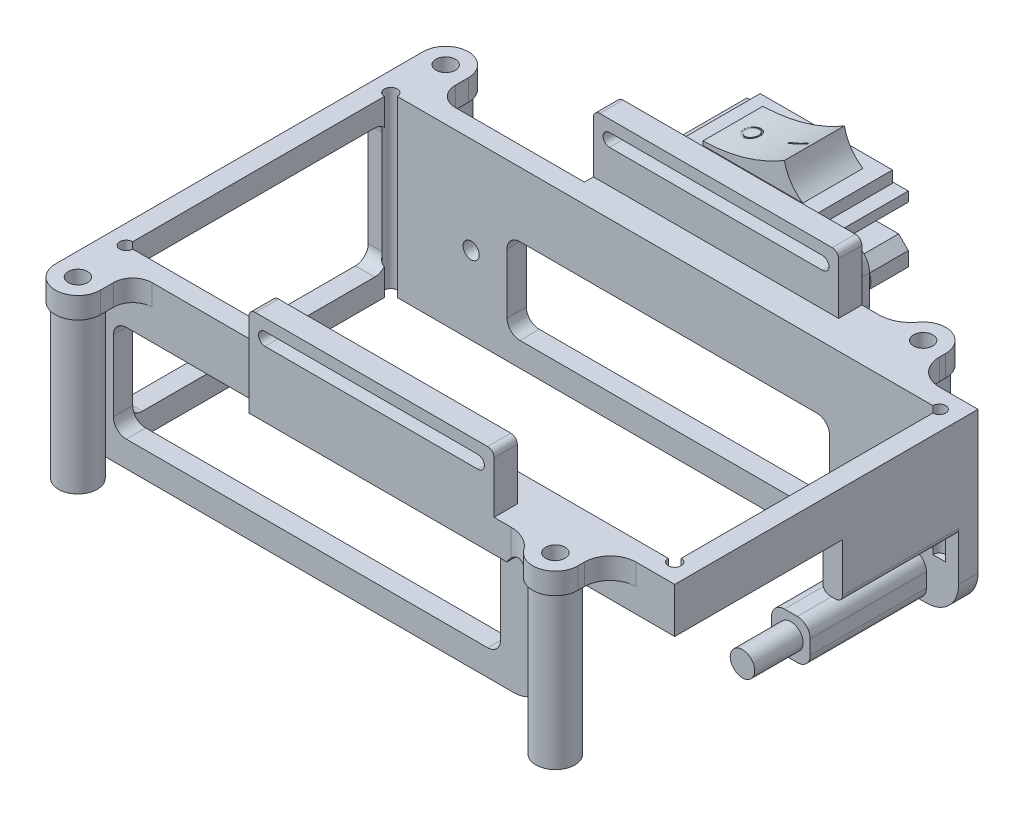
from build123d import *

# Parameters (mm, degrees)
SKETCH_1_W          = 91
SKETCH_1_H          = 47
EXTRUDE_1_DEPTH     = 27
SKETCH_2_R          = 1.5
EXTRUDE_2_DEPTH     = 3.3
SKETCH_3_W          = 38
SKETCH_3_H          = 5
SKETCH_3_W_2        = 4
SKETCH_3_H_2        = 3.3
EXTRUDE_3_DEPTH     = 5
CUT_EXTRUDE_1_DEPTH = 1.4
FILLET_1_R          = 3
FILLET_2_R          = 5
FILLET_3_R          = 4
FILLET_4_R          = 5
FILLET_5_R          = 4
FILLET_START        = -28.952063768
FILLET_6_DEPTH      = 5.952063768
FILLET_START_2      = 21
FILLET_6_2_DEPTH    = 2.7
CUT_EXTRUDE_2_DEPTH = 18.4
SKETCH_6_R          = 1.25
CUT_EXTRUDE_3_DEPTH = 18.4
CUT_EXTRUDE_4_DEPTH = 18.4
CUT_EXTRUDE_5_DEPTH = 26
FILLET_7_R          = 5
SKETCH_9_W          = 3
SKETCH_9_H          = 11.5
CUT_EXTRUDE_6_DEPTH = 18
FILLET_8_R          = 1
SKETCH_10_W         = 10
SKETCH_10_H         = 3
EXTRUDE_4_DEPTH     = 7
FILLET_9_R          = 5
EXTRUDE_5_DEPTH     = 18
SKETCH_12_R         = 1.9
EXTRUDE_6_DEPTH     = 7.5
SKETCH_13_R         = 3
SKETCH_13_R_2       = 1.5
EXTRUDE_7_DEPTH     = 23.7
EXTRUDE_8_DEPTH     = 2.7
SKETCH_15_R         = 2.5
EXTRUDE_9_DEPTH     = 1
SKETCH_17_R         = 1.25
EXTRUDE_10_DEPTH    = 11
SKETCH_18_W         = 20.5
SKETCH_18_H         = 13.5
EXTRUDE_12_DEPTH    = 1.8
EXTRUDE_13_DEPTH    = 4.65
SKETCH_20_R         = 1.25
SKETCH_20_R_2       = 1
SKETCH_20_W         = 3
SKETCH_20_H         = 0.25
CUT_EXTRUDE_7_DEPTH = 9.3


with BuildPart() as part:
    # 草图1 → 凸台-拉伸1 (new body)
    with BuildSketch(Plane(origin=(0, 0, 0), x_dir=(1, 0, 0), z_dir=(0, 1, 0))):
        Rectangle(SKETCH_1_W, SKETCH_1_H)
        with BuildLine():
            Line((-41.5, 20.5), (41.5, 20.5))
            ThreePointArc((41.5, 20.5), (43.207106781, 21.207106781), (42.5, 19.5))
            Line((42.5, 19.5), (42.5, -19.5))
            ThreePointArc((42.5, -19.5), (43.207106781, -21.207106781), (41.5, -20.5))
            Line((41.5, -20.5), (-41.5, -20.5))
            ThreePointArc((-41.5, -20.5), (-43.207106781, -21.207106781), (-42.5, -19.5))
            Line((-42.5, -19.5), (-42.5, 19.5))
            ThreePointArc((-42.5, 19.5), (-43.207106781, 21.207106781), (-41.5, 20.5))
        make_face(mode=Mode.SUBTRACT)
    extrude(amount=EXTRUDE_1_DEPTH)

    # 草图2 → 凸台-拉伸2 (add)
    # profile 1 of 4: a face of its own
    with BuildSketch(Plane(origin=(0, 27, 0), x_dir=(1, 0, 0), z_dir=(0, 1, 0))):
        with BuildLine():
            Line((-45.5, -23.5), (-45.5, -28.5))
            ThreePointArc((-45.5, -28.5), (-42, -32), (-38.5, -28.5))
            Line((-38.5, -28.5), (-38.5, -26.5))
            ThreePointArc((-38.5, -26.5), (-37.621320344, -24.378679656), (-35.5, -23.5))
            Line((-35.5, -23.5), (-45.5, -23.5))
        make_face()
        with Locations(Location((-42, -28.5, 0), (0, 0, 270))):
            Circle(SKETCH_2_R, mode=Mode.SUBTRACT)
    # profile 2 of 4: a face of its own
    with BuildSketch(Plane(origin=(0, 27, 0), x_dir=(1, 0, 0), z_dir=(0, 1, 0))):
        with BuildLine():
            ThreePointArc((-38.5, 28.5), (-42, 32), (-45.5, 28.5))
            Line((-45.5, 28.5), (-45.5, 23.5))
            Line((-45.5, 23.5), (-35.5, 23.5))
            ThreePointArc((-35.5, 23.5), (-37.621320344, 24.378679656), (-38.5, 26.5))
            Line((-38.5, 26.5), (-38.5, 28.5))
        make_face()
        with Locations(Location((-42, 28.5, 0), (0, 0, 270))):
            Circle(SKETCH_2_R, mode=Mode.SUBTRACT)
    # profile 3 of 4: a face of its own
    with BuildSketch(Plane(origin=(0, 27, 0), x_dir=(1, 0, 0), z_dir=(0, 1, 0))):
        with BuildLine():
            Line((28.5, -23.5), (28.5, -28.5))
            ThreePointArc((28.5, -28.5), (32, -32), (35.5, -28.5))
            Line((35.5, -28.5), (35.5, -23.5))
            Line((35.5, -23.5), (28.5, -23.5))
        make_face()
        with Locations(Location((32, -28.5, 0), (0, 0, 270))):
            Circle(SKETCH_2_R, mode=Mode.SUBTRACT)
    # profile 4 of 4: a face of its own
    with BuildSketch(Plane(origin=(0, 27, 0), x_dir=(1, 0, 0), z_dir=(0, 1, 0))):
        with BuildLine():
            Line((28.5, 23.5), (35.5, 23.5))
            Line((35.5, 23.5), (35.5, 28.5))
            ThreePointArc((35.5, 28.5), (32, 32), (28.5, 28.5))
            Line((28.5, 28.5), (28.5, 23.5))
        make_face()
        with Locations(Location((32, 28.5, 0), (0, 0, 270))):
            Circle(SKETCH_2_R, mode=Mode.SUBTRACT)
    extrude(amount=-EXTRUDE_2_DEPTH)

    # 草图3 → 凸台-拉伸3 (add)
    # profile 1 of 4: a face of its own
    with BuildSketch(Plane.XY.offset(23.5)):
        with BuildLine():
            Line((21.5, 36), (-14.5, 36))
            ThreePointArc((-14.5, 36), (-15.207106781, 35.707106781), (-15.5, 35))
            Line((-15.5, 35), (-15.5, 27))
            Line((-15.5, 27), (22.5, 27))
            Line((22.5, 27), (22.5, 35))
            ThreePointArc((22.5, 35), (22.207106781, 35.707106781), (21.5, 36))
        make_face()
        with BuildLine():
            ThreePointArc((-13, 32.2), (-14, 33.2), (-13, 34.2))
            Line((-13, 34.2), (20, 34.2))
            ThreePointArc((20, 34.2), (21, 33.2), (20, 32.2))
            Line((20, 32.2), (-13, 32.2))
        make_face(mode=Mode.SUBTRACT)
    # profile 2 of 4: a face of its own
    with BuildSketch(Plane.XY.offset(23.5)):
        with Locations((3.5, 24.5)):
            Rectangle(SKETCH_3_W, SKETCH_3_H)
    # profile 3 of 4: a face of its own
    with BuildSketch(Plane.XY.offset(23.5)):
        Polygon((24.5, 27), (22.5, 27), (22.5, 22), (24.5, 22), (24.5, 23.7), align=None)
    # profile 4 of 4: a face of its own
    with BuildSketch(Plane.XY.offset(23.5)):
        with Locations((26.5, 25.35)):
            Rectangle(SKETCH_3_W_2, SKETCH_3_H_2)
    extrude_3 = extrude(amount=EXTRUDE_3_DEPTH)

    # 草图4 → 切除-拉伸1 (cut)
    with BuildSketch(Plane(origin=(0, 0, 23.5), x_dir=(-1, 0, 0), z_dir=(0, 0, -1))):
        with BuildLine():
            Line((-22.5, 27), (15.5, 27))
            Line((15.5, 27), (15.5, 35))
            ThreePointArc((15.5, 35), (15.207106781, 35.707106781), (14.5, 36))
            Line((14.5, 36), (-21.5, 36))
            ThreePointArc((-21.5, 36), (-22.207106781, 35.707106781), (-22.5, 35))
            Line((-22.5, 35), (-22.5, 27))
        make_face()
    cut_extrude_1 = extrude(amount=-CUT_EXTRUDE_1_DEPTH, mode=Mode.SUBTRACT)

    # 圆角1
    # the kernel refuses this fillet: 3 mm, written as the material it adds along each edge
    with BuildSketch(Plane(origin=(24.5, 23.7, 23.5), x_dir=(1, 0, 0), z_dir=(0, 0, 1))) as fillet_1_piece_1:
        with BuildLine():
            CenterArc((2.703701167, -3), FILLET_1_R, 90, 64.320711381)
            Line((0, -1.7), (-0.054074023, -1.674))
            ThreePointArc((-0.054074023, -1.674), (-0.06, -0.85), (-0.06, 0))
            Line((-0.06, 0), (0, 0.06))
            Line((0, 0.06), (2.703701167, 0.06))
            Line((2.703701167, 0.06), (2.703701167, 0))
        make_face()
    extrude(amount=5)

    # 圆角2
    fillet_2_edges = [part.edges().sort_by_distance(p)[0] for p in [
        (28.5, 25.35, 28.5),
    ]]
    fillet(fillet_2_edges, radius=FILLET_2_R)

    # 圆角3
    fillet_3_edges = [part.edges().sort_by_distance(p)[0] for p in [
        (35.5, 25.35, 23.5),
    ]]
    fillet(fillet_3_edges, radius=FILLET_3_R)

    # 镜向3: 凸台-拉伸3, 切除-拉伸1 across plane
    add(extrude_3.mirror(Plane.XY))
    add(cut_extrude_1.mirror(Plane.XY), mode=Mode.SUBTRACT)

    # 圆角4
    fillet_4_edges = [part.edges().sort_by_distance(p)[0] for p in [
        (28.5, 25.35, -28.5),
    ]]
    fillet(fillet_4_edges, radius=FILLET_4_R)

    # 圆角5
    fillet_5_edges = [part.edges().sort_by_distance(p)[0] for p in [
        (35.5, 25.35, -23.5),
    ]]
    fillet(fillet_5_edges, radius=FILLET_5_R)

    # 圆角6: read off the stored shape, not the designer's step
    # 圆角6 outline → 圆角6 (add)
    with BuildSketch(Plane.XY.offset(FILLET_START)):
        with BuildLine():
            Line((24.5, 23.7), (24.5, 22))
            ThreePointArc((24.5, 22), (25.606829225, 23.23968502), (27.203701167, 23.7))
            Line((27.203701167, 23.7), (24.5, 23.7))
        make_face()
    extrude(amount=FILLET_6_DEPTH)

    # Fillet 6 2 outline → Fillet 6 2 (cut)
    with BuildSketch(Plane(origin=(0, 0, 0), x_dir=(1, 0, 0), z_dir=(0, 1, 0)).offset(FILLET_START_2)):
        with BuildLine():
            Line((24.5, 28.5), (25.126136458, 28.5))
            ThreePointArc((25.126136458, 28.5), (26.189225924, 28.614322894), (27.203701205, 28.952063686))
            Line((27.203701205, 28.952063686), (24.5, 28.952063768))
            Line((24.5, 28.952063768), (24.5, 28.5))
        make_face()
    extrude(amount=FILLET_6_2_DEPTH, mode=Mode.SUBTRACT)

    # 草图5 → 切除-拉伸2 (cut)
    with BuildSketch(Plane.ZY.offset(45.5)):
        with BuildLine():
            Line((-18, 23.5), (18, 23.5))
            ThreePointArc((18, 23.5), (19.414213562, 22.914213562), (20, 21.5))
            Line((20, 21.5), (20, 5.5))
            ThreePointArc((20, 5.5), (19.414213562, 4.085786438), (18, 3.5))
            Line((18, 3.5), (-18, 3.5))
            ThreePointArc((-18, 3.5), (-19.414213562, 4.085786438), (-20, 5.5))
            Line((-20, 5.5), (-20, 21.5))
            ThreePointArc((-20, 21.5), (-19.414213562, 22.914213562), (-18, 23.5))
        make_face()
    extrude(amount=-CUT_EXTRUDE_2_DEPTH, mode=Mode.SUBTRACT)

    # 草图6 → 切除-拉伸3 (cut)
    with BuildSketch(Plane(origin=(0, 0, -23.5), x_dir=(-1, 0, 0), z_dir=(0, 0, -1))):
        with Locations((-31.05, 12.05)):
            Circle(SKETCH_6_R)
        with Locations((30.05, 12.05)):
            Circle(SKETCH_6_R)
        with BuildLine():
            Line((-23.5, 17), (22.5, 17))
            ThreePointArc((22.5, 17), (23.914213562, 16.414213562), (24.5, 15))
            Line((24.5, 15), (24.5, 5.75))
            ThreePointArc((24.5, 5.75), (23.914213562, 4.335786438), (22.5, 3.75))
            Line((22.5, 3.75), (-23.5, 3.75))
            ThreePointArc((-23.5, 3.75), (-24.914213562, 4.335786438), (-25.5, 5.75))
            Line((-25.5, 5.75), (-25.5, 15))
            ThreePointArc((-25.5, 15), (-24.914213562, 16.414213562), (-23.5, 17))
        make_face()
    extrude(amount=-CUT_EXTRUDE_3_DEPTH, mode=Mode.SUBTRACT)

    # 草图7 → 切除-拉伸4 (cut)
    with BuildSketch(Plane.XY.offset(23.5)):
        with BuildLine():
            Line((-39.5, 19), (16.5, 19))
            ThreePointArc((16.5, 19), (17.914213562, 18.414213562), (18.5, 17))
            Line((18.5, 17), (18.5, 6))
            ThreePointArc((18.5, 6), (17.914213562, 4.585786438), (16.5, 4))
            Line((16.5, 4), (-39.5, 4))
            ThreePointArc((-39.5, 4), (-40.914213562, 4.585786438), (-41.5, 6))
            Line((-41.5, 6), (-41.5, 17))
            ThreePointArc((-41.5, 17), (-40.914213562, 18.414213562), (-39.5, 19))
        make_face()
    extrude(amount=-CUT_EXTRUDE_4_DEPTH, mode=Mode.SUBTRACT)

    # 草图8 → 切除-拉伸5 (cut)
    with BuildSketch(Plane.XY.offset(23.5)):
        with BuildLine():
            Line((45.5, 0), (25.5, 0))
            Line((25.5, 0), (25.5, 15))
            ThreePointArc((25.5, 15), (26.964466094, 18.535533906), (30.5, 20))
            Line((30.5, 20), (45.5, 20))
            Line((45.5, 20), (45.5, 0))
        make_face()
    extrude(amount=-CUT_EXTRUDE_5_DEPTH, mode=Mode.SUBTRACT)

    # 圆角7
    fillet_7_edges = [part.edges().sort_by_distance(p)[0] for p in [
        (25.5, 0, 22),
    ]]
    fillet(fillet_7_edges, radius=FILLET_7_R)

    # 草图9 → 切除-拉伸6 (cut)
    with BuildSketch(Plane.XY.offset(-2.5)):
        with Locations((44, 5.75)):
            Rectangle(SKETCH_9_W, SKETCH_9_H)
    extrude(amount=-CUT_EXTRUDE_6_DEPTH, mode=Mode.SUBTRACT)

    # 圆角8
    fillet_8_edges = [part.edges().sort_by_distance(p)[0] for p in [
        (42.5, 11.5, -11),
        (45.5, 11.5, -11.5),
    ]]
    fillet(fillet_8_edges, radius=FILLET_8_R)

    # 草图10 → 凸台-拉伸4 (add)
    with BuildSketch(Plane.XZ):
        with Locations((40.5, -22)):
            Rectangle(SKETCH_10_W, SKETCH_10_H)
    extrude(amount=-EXTRUDE_4_DEPTH)

    # 圆角9
    fillet_9_edges = [part.edges().sort_by_distance(p)[0] for p in [
        (45.5, 0, -22),
    ]]
    fillet(fillet_9_edges, radius=FILLET_9_R)

    # 草图11 → 凸台-拉伸5 (add)
    with BuildSketch(Plane.XY.offset(-20.5)):
        with BuildLine():
            Line((38.5, 0), (36.5, 0))
            ThreePointArc((36.5, 0), (35.085786438, 0.585786438), (34.5, 2))
            Line((34.5, 2), (34.5, 4.2))
            ThreePointArc((34.5, 4.2), (35.085786438, 5.614213562), (36.5, 6.2))
            Line((36.5, 6.2), (38.5, 6.2))
            ThreePointArc((38.5, 6.2), (39.914213562, 5.614213562), (40.5, 4.2))
            Line((40.5, 4.2), (40.5, 2))
            ThreePointArc((40.5, 2), (39.914213562, 0.585786438), (38.5, 0))
        make_face()
    extrude(amount=EXTRUDE_5_DEPTH)

    # 草图12 → 凸台-拉伸6 (add)
    with BuildSketch(Plane.XY.offset(-2.5)):
        with Locations((37.5, 3.1)):
            Circle(SKETCH_12_R)
    extrude(amount=EXTRUDE_6_DEPTH)

    # 草图13 → 凸台-拉伸7 (add)
    # profile 1 of 4: a face of its own
    with BuildSketch(Plane.XZ.offset(-23.7)):
        with Locations(Location((-42, 28.5, 0), (0, 0, 90))):
            Circle(SKETCH_13_R)
        with Locations(Location((-42, 28.5, 0), (0, 0, 90))):
            Circle(SKETCH_13_R_2, mode=Mode.SUBTRACT)
    # profile 2 of 4: a face of its own
    with BuildSketch(Plane.XZ.offset(-23.7)):
        with Locations(Location((32, 28.5, 0), (0, 0, 90))):
            Circle(SKETCH_13_R)
        with Locations(Location((32, 28.5, 0), (0, 0, 90))):
            Circle(SKETCH_13_R_2, mode=Mode.SUBTRACT)
    # profile 3 of 4: a face of its own
    with BuildSketch(Plane.XZ.offset(-23.7)):
        with Locations(Location((32, -28.5, 0), (0, 0, 90))):
            Circle(SKETCH_13_R)
        with Locations(Location((32, -28.5, 0), (0, 0, 90))):
            Circle(SKETCH_13_R_2, mode=Mode.SUBTRACT)
    # profile 4 of 4: a face of its own
    with BuildSketch(Plane.XZ.offset(-23.7)):
        with Locations(Location((-42, -28.5, 0), (0, 0, 90))):
            Circle(SKETCH_13_R)
        with Locations(Location((-42, -28.5, 0), (0, 0, 90))):
            Circle(SKETCH_13_R_2, mode=Mode.SUBTRACT)
    extrude(amount=EXTRUDE_7_DEPTH)

    # 草图14 → 凸台-拉伸8 (add)
    with BuildSketch(Plane(origin=(0, 0, -28.5), x_dir=(-1, 0, 0), z_dir=(0, 0, -1))):
        with BuildLine():
            Line((-18, 32.2), (11, 32.2))
            ThreePointArc((11, 32.2), (13.121320344, 31.321320344), (14, 29.2))
            Line((14, 29.2), (14, 25))
            ThreePointArc((14, 25), (13.121320344, 22.878679656), (11, 22))
            Line((11, 22), (-18, 22))
            ThreePointArc((-18, 22), (-20.121320344, 22.878679656), (-21, 25))
            Line((-21, 25), (-21, 29.2))
            ThreePointArc((-21, 29.2), (-20.121320344, 31.321320344), (-18, 32.2))
        make_face()
    extrude(amount=EXTRUDE_8_DEPTH)

    # 草图15 → 凸台-拉伸9 (add)
    # profile 1 of 2: a face of its own
    with BuildSketch(Plane(origin=(0, 0, -31.2), x_dir=(-1, 0, 0), z_dir=(0, 0, -1))):
        with Locations((-17.7, 27.1)):
            Circle(SKETCH_15_R)
        Polygon((-16.545299462, 27.1), (-17.122649731, 28.1), (-18.277350269, 28.1), (-18.854700538, 27.1), (-18.277350269, 26.1), (-17.122649731, 26.1), align=None, mode=Mode.SUBTRACT)
    # profile 2 of 2: a face of its own
    with BuildSketch(Plane(origin=(0, 0, -31.2), x_dir=(-1, 0, 0), z_dir=(0, 0, -1))):
        with Locations(Location((10.7, 27.1, 0), (0, 0, 180))):
            Circle(SKETCH_15_R)
        Polygon((11.854700538, 27.1), (11.277350269, 26.1), (10.122649731, 26.1), (9.545299462, 27.1), (10.122649731, 28.1), (11.277350269, 28.1), align=None, mode=Mode.SUBTRACT)
    extrude(amount=EXTRUDE_9_DEPTH)

    # 草图17 → 凸台-拉伸10 (add)
    with BuildSketch(Plane(origin=(0, 0, -31.2), x_dir=(-1, 0, 0), z_dir=(0, 0, -1))):
        with BuildLine():
            Line((-16, 24.2), (-16, 22))
            Line((-16, 22), (9, 22))
            Line((9, 22), (9, 24.2))
            Line((9, 24.2), (7.5, 25.7))
            Line((7.5, 25.7), (3.5, 25.7))
            ThreePointArc((3.5, 25.7), (2.792893219, 25.992893219), (2.5, 26.7))
            Line((2.5, 26.7), (2.5, 29.7))
            ThreePointArc((2.5, 29.7), (2.792893219, 30.407106781), (3.5, 30.7))
            Line((3.5, 30.7), (9, 30.7))
            Line((9, 30.7), (9, 32.2))
            Line((9, 32.2), (-16, 32.2))
            Line((-16, 32.2), (-16, 30.7))
            Line((-16, 30.7), (-10.5, 30.7))
            ThreePointArc((-10.5, 30.7), (-9.792893219, 30.407106781), (-9.5, 29.7))
            Line((-9.5, 29.7), (-9.5, 26.7))
            ThreePointArc((-9.5, 26.7), (-9.792893219, 25.992893219), (-10.5, 25.7))
            Line((-10.5, 25.7), (-14.5, 25.7))
            Line((-14.5, 25.7), (-16, 24.2))
        make_face()
        with Locations((-3.5, 27.1)):
            Circle(SKETCH_17_R, mode=Mode.SUBTRACT)
    extrude(amount=EXTRUDE_10_DEPTH)

    # 草图18 → 凸台-拉伸12 (add)
    with BuildSketch(Plane(origin=(0, 32.2, 0), x_dir=(1, 0, 0), z_dir=(0, 1, 0))):
        with Locations((3.5, 35.25)):
            Rectangle(SKETCH_18_W, SKETCH_18_H)
    extrude(amount=EXTRUDE_12_DEPTH)

    # 草图19 → 凸台-拉伸13 (add, symmetric)
    with BuildSketch(Plane(origin=(0, 0, -35.25), x_dir=(-1, 0, 0), z_dir=(0, 0, -1))):
        with BuildLine():
            Line((4.25, 34), (-11.25, 34))
            add(Edge.make_bspline(
                [(-11.25, 34), (-8.972442089, 35.598590536), (-8.402107342, 38.3)],
                knots=[0, 0, 0, 1, 1, 1], degree=2))
            add(Edge.make_bspline(
                [(-8.402107342, 38.3), (-2.598379996, 34.810978973), (4.25, 34.592337347)],
                knots=[0, 0, 0, 1, 1, 1], degree=2))
            Line((4.25, 34.592337347), (4.25, 34))
        make_face()
    extrude(amount=EXTRUDE_13_DEPTH, both=True)

    # 草图20 → 切除-拉伸7 (cut)
    # profile 1 of 2: a face of its own
    with BuildSketch(Plane(origin=(0, 44, 0), x_dir=(1, 0, 0), z_dir=(0, 1, 0))):
        with Locations(Location((-1.25, 35.25, 0), (0, 0, 270))):
            Circle(SKETCH_20_R)
        with Locations(Location((-1.25, 35.25, 0), (0, 0, 270))):
            Circle(SKETCH_20_R_2, mode=Mode.SUBTRACT)
    # profile 2 of 2: a face of its own
    with BuildSketch(Plane(origin=(0, 44, 0), x_dir=(1, 0, 0), z_dir=(0, 1, 0))):
        with Locations((5.902107342, 35.25)):
            Rectangle(SKETCH_20_W, SKETCH_20_H)
    extrude(amount=-CUT_EXTRUDE_7_DEPTH, mode=Mode.SUBTRACT)


solid = part.part
